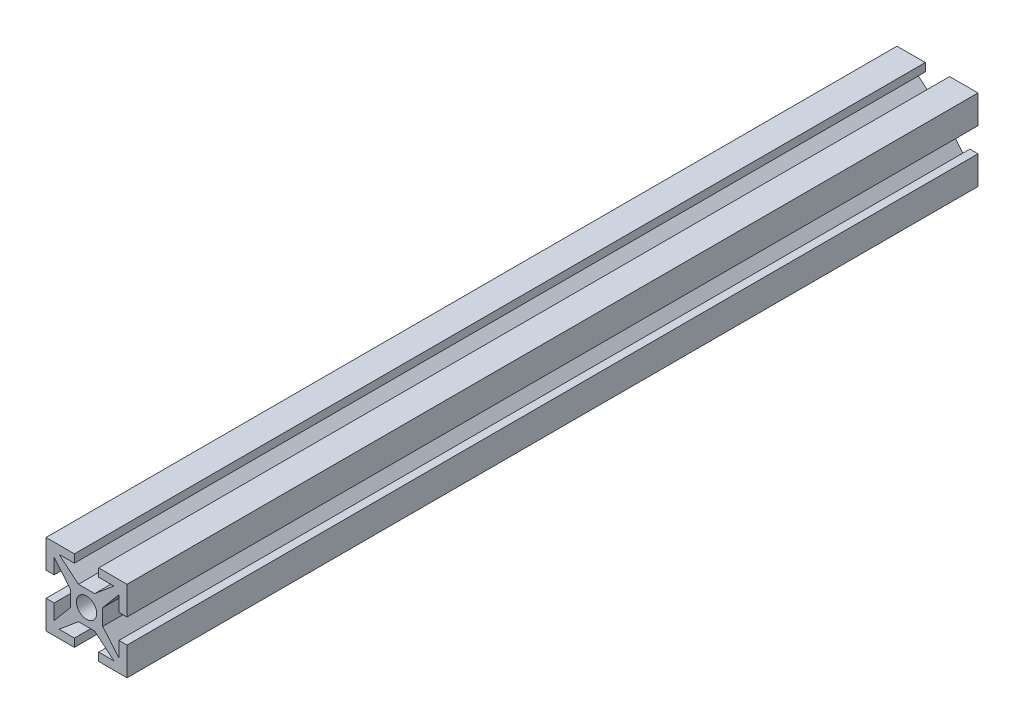
from build123d import *

# Parameters (mm, degrees)
ESQUISSE2_R        = 1.25
BOSS_EXTRU_1_DEPTH = 105


with BuildPart() as part:
    # Esquisse2 → Boss.-Extru.1 (new body)
    with BuildSketch(Plane.XY):
        Polygon((-1, -2), (1, -2), (3.383507185, -4), (1.5, -4), (1.5, -5), (5, -5), (5, -1.5), (4, -1.5), (4, -3.383507185), (2, -1), (2, 1), (4, 3.383507185), (4, 1.5), (5, 1.5), (5, 5), (1.5, 5), (1.5, 4), (3.383507185, 4), (1, 2), (-1, 2), (-3.383507185, 4), (-1.5, 4), (-1.5, 5), (-5, 5), (-5, 1.5), (-4, 1.5), (-4, 3.383507185), (-2, 1), (-2, -1), (-4, -3.383507185), (-4, -1.5), (-5, -1.5), (-5, -5), (-1.5, -5), (-1.5, -4), (-3.383507185, -4), align=None)
        Circle(ESQUISSE2_R, mode=Mode.SUBTRACT)
    extrude(amount=BOSS_EXTRU_1_DEPTH)


solid = part.part
